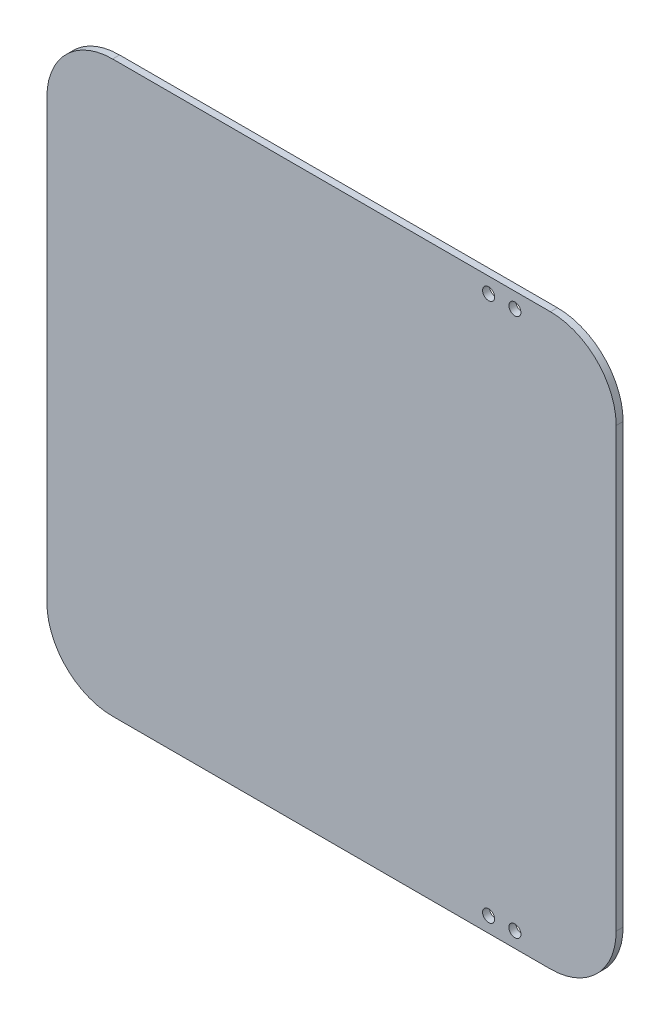
from build123d import *

# Parameters (mm, degrees)
BOSS_EXTRUDE1_DEPTH = 3.175
SKETCH2_R           = 2.75
CUT_EXTRUDE1_DEPTH  = 349.366795463


with BuildPart() as part:
    # Sketch1 → Boss-Extrude1 (new body)
    with BuildSketch(Plane.XY):
        with BuildLine():
            Line((79.71677043, 314.26787056), (-120.28322957, 314.26787056))
            ThreePointArc((-120.28322957, 314.26787056), (-141.496433005, 305.481073996), (-150.28322957, 284.26787056))
            Line((-150.28322957, 284.26787056), (-150.28322957, 84.26787056))
            ThreePointArc((-150.28322957, 84.26787056), (-141.496433005, 63.054667125), (-120.28322957, 54.26787056))
            Line((-120.28322957, 54.26787056), (79.71677043, 54.26787056))
            ThreePointArc((79.71677043, 54.26787056), (100.929973866, 63.054667125), (109.71677043, 84.26787056))
            Line((109.71677043, 84.26787056), (109.71677043, 284.26787056))
            ThreePointArc((109.71677043, 284.26787056), (100.929973866, 305.481073996), (79.71677043, 314.26787056))
        make_face()
    extrude(amount=-BOSS_EXTRUDE1_DEPTH)

    # Sketch2 → Cut-Extrude1 (cut, through all)
    with BuildSketch(Plane.XY):
        with Locations((51.46677043, 307.267870599)):
            Circle(SKETCH2_R)
        with Locations((63.46677043, 307.267870599)):
            Circle(SKETCH2_R)
        with Locations((63.46677043, 61.26787056)):
            Circle(SKETCH2_R)
        with Locations((51.46677043, 61.26787056)):
            Circle(SKETCH2_R)
    extrude(amount=-CUT_EXTRUDE1_DEPTH, mode=Mode.SUBTRACT)


solid = part.part
